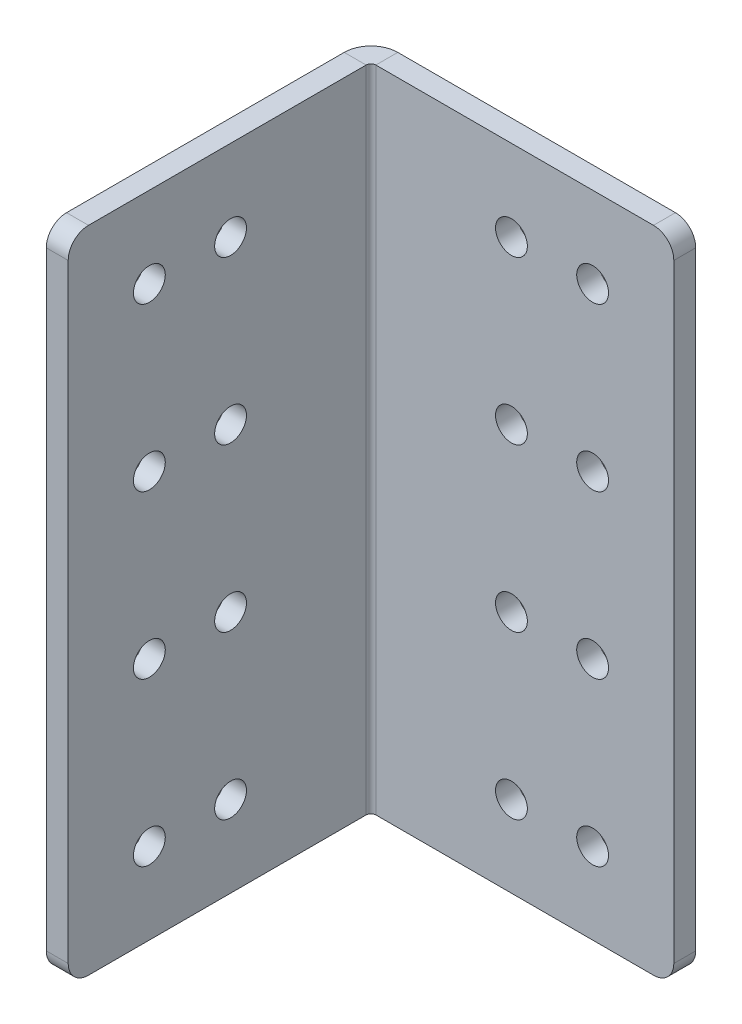
from build123d import *

# Parameters (mm, degrees)
BASE_FLANGE1_DEPTH = 50.8
SKETCH6_R          = 2.4892
CUT_EXTRUDE1_DEPTH = 87.054004212
SKETCH7_R          = 2.4892
CUT_EXTRUDE2_DEPTH = 87.054004212
FILLET1_R          = 3.175


# Sheet-metal steps are written as plain solids
with BuildPart() as part:
    # Sketch1 → Base-Flange1 (new, symmetric)
    with BuildSketch(Plane(origin=(0, 0, 0), x_dir=(1, 0, 0), z_dir=(0, 1, 0))):
        with BuildLine():
            Line((50.8, 0), (4.191, 0))
            ThreePointArc((4.191, 0), (1.22751548, -1.22751548), (0, -4.191))
            Line((0, -4.191), (0, -50.8))
            Line((0, -50.8), (3.429, -50.8))
            Line((3.429, -50.8), (3.429, -4.191))
            ThreePointArc((3.429, -4.191), (3.652184633, -3.652184633), (4.191, -3.429))
            Line((4.191, -3.429), (50.8, -3.429))
            Line((50.8, -3.429), (50.8, 0))
        make_face()
    extrude(amount=BASE_FLANGE1_DEPTH, both=True)

    # Sketch6 → Cut-Extrude1 (cut, through all)
    with BuildSketch(Plane(origin=(3.429, 0, 0), x_dir=(0, 0, -1), z_dir=(1, 0, 0))):
        with Locations((-38.1, 38.1)):
            Circle(SKETCH6_R)
        with Locations((-25.4, 38.1)):
            Circle(SKETCH6_R)
        with Locations((-38.1, 12.7)):
            Circle(SKETCH6_R)
        with Locations((-25.4, 12.7)):
            Circle(SKETCH6_R)
        with Locations((-38.1, -12.7)):
            Circle(SKETCH6_R)
        with Locations((-25.4, -12.7)):
            Circle(SKETCH6_R)
        with Locations((-38.1, -38.1)):
            Circle(SKETCH6_R)
        with Locations((-25.4, -38.1)):
            Circle(SKETCH6_R)
    extrude(amount=-CUT_EXTRUDE1_DEPTH, mode=Mode.SUBTRACT)

    # Sketch7 → Cut-Extrude2 (cut, through all)
    with BuildSketch(Plane.XY.offset(3.429)):
        with Locations((25.4, 38.1)):
            Circle(SKETCH7_R)
        with Locations((38.1, 38.1)):
            Circle(SKETCH7_R)
        with Locations((25.4, 12.7)):
            Circle(SKETCH7_R)
        with Locations((38.1, 12.7)):
            Circle(SKETCH7_R)
        with Locations((25.4, -12.7)):
            Circle(SKETCH7_R)
        with Locations((38.1, -12.7)):
            Circle(SKETCH7_R)
        with Locations((25.4, -38.1)):
            Circle(SKETCH7_R)
        with Locations((38.1, -38.1)):
            Circle(SKETCH7_R)
    extrude(amount=-CUT_EXTRUDE2_DEPTH, mode=Mode.SUBTRACT)

    # Fillet1
    fillet1_edges = [part.edges().sort_by_distance(p)[0] for p in [
        (1.7145, 50.8, 50.8),
        (1.7145, -50.8, 50.8),
        (50.8, 50.8, 1.7145),
        (50.8, -50.8, 1.7145),
    ]]
    fillet(fillet1_edges, radius=FILLET1_R)


solid = part.part
